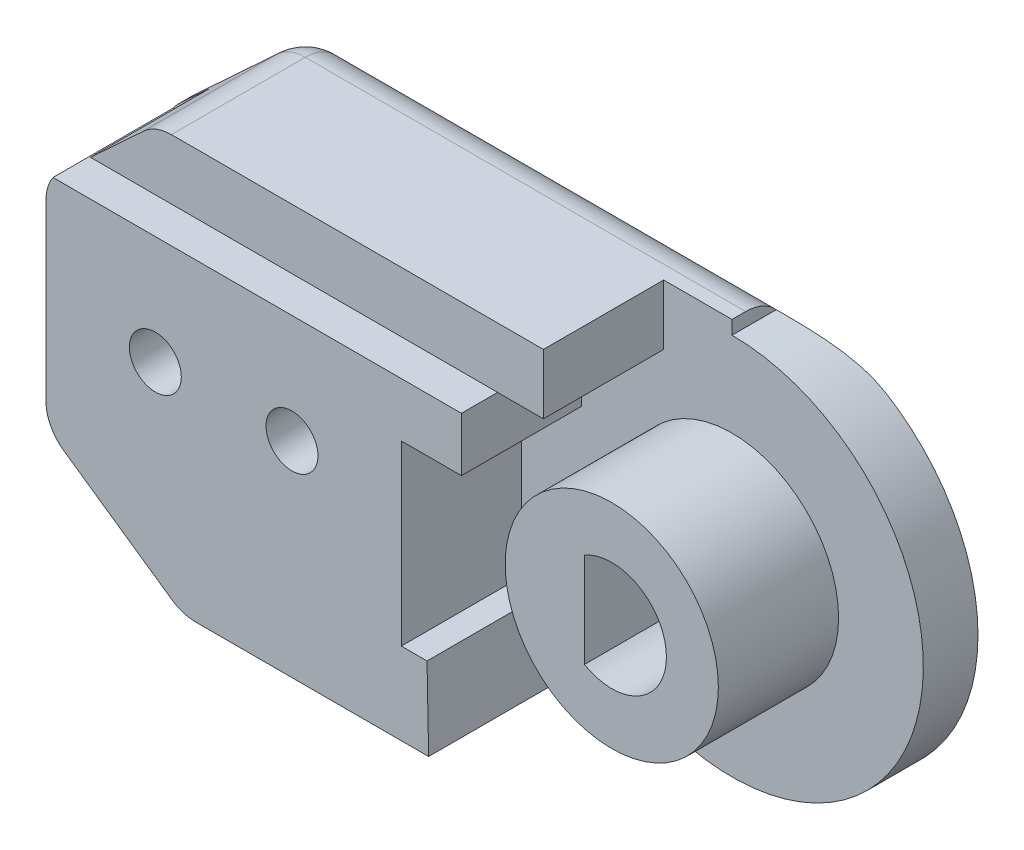
from build123d import *

# Parameters (mm, degrees)
BOSS_EXTRUDE1_DEPTH      = 2
BOSS_EXTRUDE2_DEPTH      = 8
SKETCH24_R               = 3.9
BOSS_EXTRUDE5_DEPTH      = 4.4
SKETCH30_W               = 4.40861202
SKETCH30_H               = 1.324178481
CUT_EXTRUDE12_DEPTH      = 16
CUT_EXTRUDE11_DEPTH      = 23.928148639
FILLET1_R                = 1.5
SKETCH34_R               = 0.75
CUT_EXTRUDE13_DEPTH      = 8
SKETCH35_R               = 0.75
CUT_EXTRUDE14_DEPTH      = 3
CUT_EXTRUDE14_DEPTH_BACK = 8
SKETCH36_R               = 0.95
CUT_EXTRUDE15_DEPTH      = 8
SKETCH37_R               = 2
CUT_EXTRUDE16_DEPTH      = 4.5
SKETCH38_W               = 3
SKETCH38_H               = 1.25
CUT_EXTRUDE17_DEPTH      = 3.6


with BuildPart() as part:
    # Sketch2 → Boss-Extrude1 (new body)
    with BuildSketch(Plane.XY):
        with BuildLine():
            Line((-2.5, 7.5), (-16.7, 7.5))
            Line((-16.7, 7.5), (-20.7, 3.793442666))
            Line((-20.7, 3.793442666), (-20.7, -4.031648778))
            Line((-20.7, -4.031648778), (-15.7, -7.5))
            Line((-15.7, -7.5), (-6.7, -7.5))
            Line((-6.7, -7.5), (-4.2, -5.6))
            ThreePointArc((-4.2, -5.6), (3.130495168, -6.260990337), (7, 0))
            ThreePointArc((7, 0), (4.949747468, 4.949747468), (0, 7))
            Line((0, 7), (0, 7.5))
            Line((0, 7.5), (-2.5, 7.5))
        make_face()
    extrude(amount=BOSS_EXTRUDE1_DEPTH)

    # Sketch4 → Boss-Extrude2 (add)
    with BuildSketch(Plane.XY.offset(2)):
        Polygon((-15.7, -7.5), (-6.7, -7.5), (-6.759079174, -4.5), (-7.7, -4.5), (-7.7, 2), (-5.5, 2), (-5.5, 5.3), (-2.5, 5.3), (-2.5, 7.5), (-16.7, 7.5), (-20.7, 3.793442666), (-20.7, -4.031648778), align=None)
    extrude(amount=BOSS_EXTRUDE2_DEPTH)

    # Sketch24 → Boss-Extrude5 (add)
    with BuildSketch(Plane.XY.offset(2)):
        Circle(SKETCH24_R)
    extrude(amount=BOSS_EXTRUDE5_DEPTH)

    # Sketch30 → Cut-Extrude12 (cut)
    with BuildSketch(Plane(origin=(-5.5, 0, 0), x_dir=(0, 0, -1), z_dir=(1, 0, 0))):
        with Locations((-4.20430601, 4.63791076)):
            Rectangle(SKETCH30_W, SKETCH30_H)
    extrude(amount=-CUT_EXTRUDE12_DEPTH, mode=Mode.SUBTRACT)

    # Sketch28 → Cut-Extrude11 (cut, through all)
    with BuildSketch(Plane.XY.offset(6.4)):
        with BuildLine():
            Line((-1, 1.732050808), (-1, -1.732050808))
            ThreePointArc((-1, -1.732050808), (2, 0), (-1, 1.732050808))
        make_face()
    extrude(amount=-CUT_EXTRUDE11_DEPTH, mode=Mode.SUBTRACT)

    # Fillet1
    # the kernel refuses this fillet: 1.5 mm, written as the material it takes off along each edge
    with BuildSketch(Plane(origin=(-15.230677435, -6, 1.5), x_dir=(-0.5699665637840448, -0.8216678867816415, 0), z_dir=(0, 0, -1))) as fillet1_piece_1_section:
        Polygon((0, 0), (FILLET1_R * 1.02, 0), (FILLET1_R * 1.02, -FILLET1_R * 0.319139344377), (FILLET1_R * 0.838101244517, -FILLET1_R * 0.58136589506), align=None)
    fillet1_piece_1 = extrude(amount=FILLET1_R * 1.02, mode=Mode.PRIVATE)
    fillet1_piece_1 = fillet1_piece_1 - Plane(origin=(-15.230677435, -6, 1.5), x_dir=(0.29860685961507855, 0.9543762064253388, 0), z_dir=(0, 0, -1)) * Sphere(FILLET1_R, mode=Mode.PRIVATE)
    add(fillet1_piece_1, mode=Mode.SUBTRACT)
    with BuildSketch(Plane(origin=(-16.11186344, 6, 1.5), x_dir=(-0.6796897201843015, 0.7334997506991983, 0), z_dir=(0, 0, -1))) as fillet1_piece_2_section:
        Polygon((0, 0), (FILLET1_R * 1.02, 0), (FILLET1_R * 1.02, FILLET1_R * 0.399932860855), (FILLET1_R * 0.748169745713, FILLET1_R * 0.693283514588), align=None)
    fillet1_piece_2 = extrude(amount=FILLET1_R * 1.02, mode=Mode.PRIVATE)
    fillet1_piece_2 = fillet1_piece_2 - Plane(origin=(-16.11186344, 6, 1.5), x_dir=(0.3650344157067945, -0.9309940254102596, 0), z_dir=(0, 0, -1)) * Sphere(FILLET1_R, mode=Mode.PRIVATE)
    add(fillet1_piece_2, mode=Mode.SUBTRACT)
    with BuildSketch(Plane(origin=(-19.2, 3.138411196, 1.5), x_dir=(-0.6796897201843015, 0.7334997506991983, 0), z_dir=(0, 0, -1))) as fillet1_piece_3_section:
        Polygon((0, 0), (FILLET1_R * 1.02, 0), (FILLET1_R * 1.02, -FILLET1_R * 0.445421399395), (FILLET1_R * 0.693283514588, -FILLET1_R * 0.748169745713), align=None)
    fillet1_piece_3 = extrude(amount=FILLET1_R * 1.02, mode=Mode.PRIVATE)
    fillet1_piece_3 = fillet1_piece_3 - Plane(origin=(-19.2, 3.138411196, 1.5), x_dir=(0.9164304993244992, -0.40019387789901173, 0), z_dir=(0, 0, -1)) * Sphere(FILLET1_R, mode=Mode.PRIVATE)
    add(fillet1_piece_3, mode=Mode.SUBTRACT)
    with BuildSketch(Plane(origin=(-19.2, -3.246599046, 1.5), x_dir=(-0.5699665637840448, -0.8216678867816415, 0), z_dir=(0, 0, -1))) as fillet1_piece_4_section:
        Polygon((0, 0), (FILLET1_R * 1.02, 0), (FILLET1_R * 1.02, FILLET1_R * 0.533833817771), (FILLET1_R * 0.58136589506, FILLET1_R * 0.838101244517), align=None)
    fillet1_piece_4 = extrude(amount=FILLET1_R * 1.02, mode=Mode.PRIVATE)
    fillet1_piece_4 = fillet1_piece_4 - Plane(origin=(-19.2, -3.246599046, 1.5), x_dir=(0.8859928227090906, 0.46369895202380795, 0), z_dir=(0, 0, -1)) * Sphere(FILLET1_R, mode=Mode.PRIVATE)
    add(fillet1_piece_4, mode=Mode.SUBTRACT)
    with BuildSketch(Plane(origin=(-15.230677435, -7.5, 0), x_dir=(0, 1, 0), z_dir=(1, 0, 0))) as fillet1_piece_5_section:
        with BuildLine():
            CenterArc((FILLET1_R, FILLET1_R), FILLET1_R, 180, 90)
            Line((0, FILLET1_R), (0, 0))
            Line((0, 0), (FILLET1_R, 0))
        make_face()
    fillet1_piece_5 = extrude(amount=12.280677435, mode=Mode.PRIVATE)
    fillet1_piece_5 = split(fillet1_piece_5, bisect_by=Plane(origin=(-9.092127217, -9.318016685, 0.3282266), z_dir=(-0.6050832675335577, 0.7961621941231027, 0)), keep=Keep.TOP, mode=Mode.PRIVATE)
    add(fillet1_piece_5, mode=Mode.SUBTRACT)
    with BuildSketch(Plane(origin=(3.75, 7.5, 0), x_dir=(0, 0, 1), z_dir=(-1, 0, 0))) as fillet1_piece_6:
        with BuildLine():
            CenterArc((FILLET1_R, -FILLET1_R), FILLET1_R, 90, 90)
            Line((0, -FILLET1_R), (0, 0))
            Line((0, 0), (FILLET1_R, 0))
        make_face()
    extrude(amount=19.86186344, mode=Mode.SUBTRACT)
    with BuildSketch(Plane(origin=(-17.13139802, 7.100249626, 0), x_dir=(0.6796897201843014, -0.7334997506991981, 0), z_dir=(-0.7334997506991983, -0.6796897201843015, 0))) as fillet1_piece_7:
        with BuildLine():
            CenterArc((FILLET1_R, FILLET1_R), FILLET1_R, 180, 90)
            Line((0, FILLET1_R), (0, 0))
            Line((0, 0), (FILLET1_R, 0))
        make_face()
    extrude(amount=4.21013989, mode=Mode.SUBTRACT)
    with BuildSketch(Plane(origin=(-20.054949846, -4.479100876, 0), x_dir=(0.5699665637840448, 0.8216678867816416, 0), z_dir=(0.8216678867816415, -0.5699665637840448, 0))) as fillet1_piece_8:
        with BuildLine():
            CenterArc((FILLET1_R, FILLET1_R), FILLET1_R, 180, 90)
            Line((0, FILLET1_R), (0, 0))
            Line((0, 0), (FILLET1_R, 0))
        make_face()
    extrude(amount=4.830811364, mode=Mode.SUBTRACT)
    with BuildSketch(Plane(origin=(-20.7, 3.138411196, 0), x_dir=(1, 0, 0), z_dir=(0, -1, 0))) as fillet1_piece_9:
        with BuildLine():
            CenterArc((FILLET1_R, FILLET1_R), FILLET1_R, 180, 90)
            Line((0, FILLET1_R), (0, 0))
            Line((0, 0), (FILLET1_R, 0))
        make_face()
    extrude(amount=6.385010242, mode=Mode.SUBTRACT)
    with BuildSketch(Plane(origin=(-15.7, -7.5, 1.5), x_dir=(1, 0, 0), z_dir=(0, 0, 1))) as fillet1_piece_10:
        with BuildLine():
            CenterArc((FILLET1_R * 0.312881710173, FILLET1_R), FILLET1_R, 235.252105822, 34.747894178)
            Line((-FILLET1_R * 0.257084853611, FILLET1_R * 0.178332113218), (0, 0))
            Line((0, 0), (FILLET1_R * 0.312881710173, 0))
        make_face()
    extrude(amount=9.673306413, mode=Mode.SUBTRACT)
    with BuildSketch(Plane(origin=(-20.7, -4.031648778, 1.5), x_dir=(0, 1, 0), z_dir=(0, 0, 1))) as fillet1_piece_11:
        with BuildLine():
            CenterArc((FILLET1_R * 0.523366488011, -FILLET1_R), FILLET1_R, 90, 55.252105822)
            Line((-FILLET1_R * 0.298301398771, -FILLET1_R * 0.430033436216), (0, 0))
            Line((0, 0), (FILLET1_R * 0.523366488011, 0))
        make_face()
    extrude(amount=10.46262433, mode=Mode.SUBTRACT)
    with BuildSketch(Plane(origin=(-20.7, 3.793442666, 1.5), x_dir=(0.7334997506991984, 0.6796897201843014, 0), z_dir=(0, 0, 1))) as fillet1_piece_12:
        with BuildLine():
            CenterArc((FILLET1_R * 0.436687646465, -FILLET1_R), FILLET1_R, 90, 47.18059856)
            Line((-FILLET1_R * 0.296812104234, -FILLET1_R * 0.320310279816), (0, 0))
            Line((0, 0), (FILLET1_R * 0.436687646465, 0))
        make_face()
    extrude(amount=10.137578674, mode=Mode.SUBTRACT)
    with BuildSketch(Plane(origin=(-16.7, 7.5, 1.5), x_dir=(1, 0, 0), z_dir=(0, 0, 1))) as fillet1_piece_13:
        with BuildLine():
            CenterArc((FILLET1_R * 0.392091040054, -FILLET1_R), FILLET1_R, 90, 42.81940144)
            Line((-FILLET1_R * 0.287598680131, -FILLET1_R * 0.266500249301), (0, 0))
            Line((0, 0), (FILLET1_R * 0.392091040054, 0))
        make_face()
    extrude(amount=9.9703414, mode=Mode.SUBTRACT)

    # Sketch34 → Cut-Extrude13 (cut, along a direction that is not the sketch's normal)
    with BuildSketch(Plane.XZ.offset(-2)):
        with Locations((-7, 10)):
            Circle(SKETCH34_R)
    extrude(amount=-CUT_EXTRUDE13_DEPTH, dir=(0.6685833876565112, -0.7436371788377336, 0), mode=Mode.SUBTRACT)

    # Sketch35 → Cut-Extrude14 (cut, two sides, along a direction that is not the sketch's normal)
    with BuildSketch(Plane(origin=(0, -4.5, 0), x_dir=(1, 0, 0), z_dir=(0, 1, 0))) as cut_extrude14_sk:
        with Locations((-8.259079174, -10)):
            Circle(SKETCH35_R)
    extrude(amount=CUT_EXTRUDE14_DEPTH, dir=(0.5999194182208608, 0.8000604299935998, 0), mode=Mode.SUBTRACT)
    extrude(cut_extrude14_sk.sketch, amount=-CUT_EXTRUDE14_DEPTH_BACK, dir=(0.5999194182208608, 0.8000604299935998, 0), mode=Mode.SUBTRACT)

    # Sketch36 → Cut-Extrude15 (cut)
    with BuildSketch(Plane.XY.offset(10)):
        with Locations((-11.7, 0)):
            Circle(SKETCH36_R)
        with Locations((-16.7, 0)):
            Circle(SKETCH36_R)
    extrude(amount=-CUT_EXTRUDE15_DEPTH, mode=Mode.SUBTRACT)

    # Sketch37 → Cut-Extrude16 (cut)
    with BuildSketch(Plane(origin=(0, 0, 0), x_dir=(-1, 0, 0), z_dir=(0, 0, -1))):
        with Locations((11.7, 0)):
            Circle(SKETCH37_R)
        with Locations((16.7, 0)):
            Circle(SKETCH37_R)
    extrude(amount=-CUT_EXTRUDE16_DEPTH, mode=Mode.SUBTRACT)

    # Sketch38 → Cut-Extrude17 (cut)
    with BuildSketch(Plane.XY.offset(10)):
        with Locations((-4, 5.925)):
            Rectangle(SKETCH38_W, SKETCH38_H)
    extrude(amount=-CUT_EXTRUDE17_DEPTH, mode=Mode.SUBTRACT)


with BuildPart() as body_2:
    # Split1: the piece on the far side of the plane
    add(part.part)
    split(bisect_by=Plane.XY.offset(6.4), keep=Keep.BOTTOM)


with BuildPart() as part_1:
    add(part.part)

    # Split1
    split(bisect_by=Plane.XY.offset(6.4), keep=Keep.TOP)


solid = body_2.part
